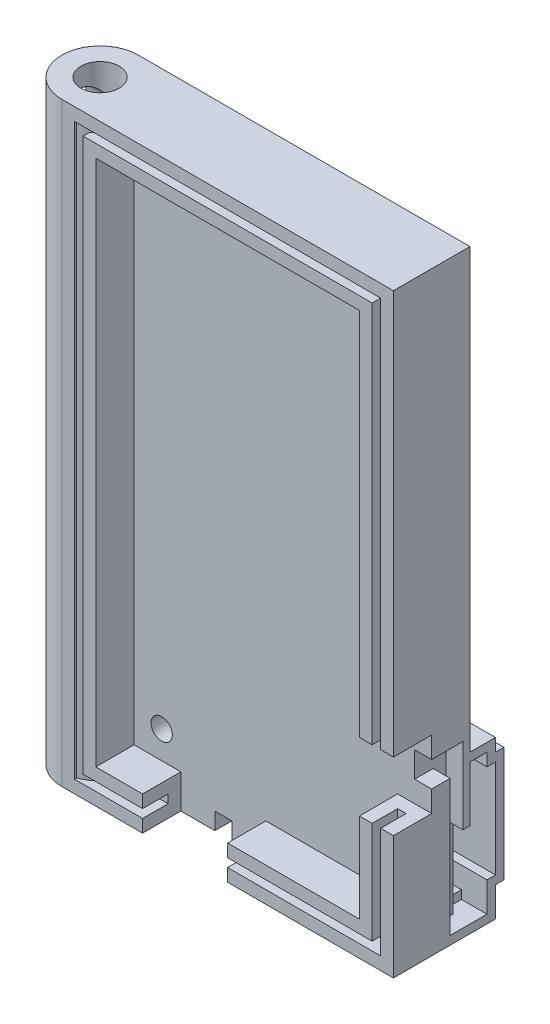
from build123d import *

# Parameters (mm, degrees)
SKETCH1_W                = 39
SKETCH1_H                = 70
BASE_DEPTH               = 4.5
SKETCH2_W                = 39
SKETCH2_H                = 70
SKETCH2_W_2              = 31
SKETCH2_H_2              = 62
WALLS_DEPTH              = 4.5
SKETCH3_W                = 10
SKETCH3_H                = 4.5
PWR_CONNECTOR_HOLE_DEPTH = 4
SKETCH4_W                = 4.5
SKETCH4_H                = 8
GPS_CONNECTOR_HOLE_DEPTH = 4
SKETCH5_R                = 1.25
MOUNTING_HOLES_DEPTH     = 4
GPS_MOUNT_DEPTH          = 3
SKETCH8_W                = 1
SKETCH8_H                = 1
GPS_RAILS_DEPTH          = 28
SKETCH9_W                = 1
SKETCH9_H                = 16.5
GPS_ROOF_DEPTH           = 14
SKETCH10_W               = 1
SKETCH10_H               = 1.5
SKETCH10_H_2             = 3.5
GPS_ROOF_2_DEPTH         = 17
SKETCH18_W               = 18
SKETCH18_H               = 1
CHIP_ROOF1_DEPTH         = 1
SKETCH19_W               = 18
SKETCH19_H               = 1
CHIP_ROOF2_DEPTH         = 12.5
SKETCH11_W               = 1
SKETCH11_H               = 3
PWR_CABLE_HOLDER1_DEPTH  = 3
PWR_CABLE_HOLDER2_DEPTH  = 2
GPS_CABLE_HOLDER_DEPTH   = 2
SKETCH14_W               = 36
SKETCH14_H               = 67
SKETCH14_W_2             = 34
SKETCH14_H_2             = 65
LID_MOUNT_DEPTH          = 3
SKETCH15_R               = 4.5
BALLON_MOUNT_DEPTH       = 70
SKETCH16_R               = 2.25
BALLOON_MOUNT_HOLE_DEPTH = 70
SKETCH17_W               = 2
SKETCH17_H               = 62
CORRECTION_DEPTH         = 4.5
SKETCH21_R               = 2.25
SAFETY_MOUNT_DEPTH       = 4.5


with BuildPart() as part:
    # Sketch1 → Base (new body)
    with BuildSketch(Plane.XY):
        with Locations((19.5, 35)):
            Rectangle(SKETCH1_W, SKETCH1_H)
    extrude(amount=BASE_DEPTH)

    # Sketch2 → Walls (add)
    with BuildSketch(Plane.XY.offset(4.5)):
        with Locations((19.5, 35)):
            Rectangle(SKETCH2_W, SKETCH2_H)
        with Locations((19.5, 35)):
            Rectangle(SKETCH2_W_2, SKETCH2_H_2, mode=Mode.SUBTRACT)
    extrude(amount=WALLS_DEPTH)

    # Sketch3 → PWR connector hole (cut)
    with BuildSketch(Plane(origin=(0, 4, 0), x_dir=(1, 0, 0), z_dir=(0, 1, 0))):
        with Locations((14.5, -6.75)):
            Rectangle(SKETCH3_W, SKETCH3_H)
    extrude(amount=-PWR_CONNECTOR_HOLE_DEPTH, mode=Mode.SUBTRACT)

    # Sketch4 → GPS connector hole (cut)
    with BuildSketch(Plane.ZY.offset(-35)):
        with Locations((6.75, 18.5)):
            Rectangle(SKETCH4_W, SKETCH4_H)
    extrude(amount=-GPS_CONNECTOR_HOLE_DEPTH, mode=Mode.SUBTRACT)

    # Sketch5 → Mounting holes (cut)
    with BuildSketch(Plane.XY.offset(4.5)):
        with Locations((7.25, 7.25)):
            Circle(SKETCH5_R)
        with Locations((31.75, 7.25)):
            Circle(SKETCH5_R)
        with Locations((7.25, 62.75)):
            Circle(SKETCH5_R)
    extrude(amount=-MOUNTING_HOLES_DEPTH, mode=Mode.SUBTRACT)

    # Sketch7 → GPS mount (add)
    with BuildSketch(Plane(origin=(0, 0, 0), x_dir=(-1, 0, 0), z_dir=(0, 0, -1))):
        Polygon((-8, 1), (-39, 1), (-39, 0), (-7, 0), (-7, 18.5), (-39, 18.5), (-39, 17.5), (-8, 17.5), align=None)
    extrude(amount=GPS_MOUNT_DEPTH)

    # Sketch8 → GPS rails (add)
    with BuildSketch(Plane(origin=(8, 0, 0), x_dir=(0, 0, -1), z_dir=(1, 0, 0))):
        with Locations((1.5, 17)):
            Rectangle(SKETCH8_W, SKETCH8_H)
        with Locations((1.5, 1.5)):
            Rectangle(SKETCH8_W, SKETCH8_H)
    extrude(amount=GPS_RAILS_DEPTH)

    # Sketch9 → GPS _roof (add)
    with BuildSketch(Plane(origin=(8, 0, 0), x_dir=(0, 0, -1), z_dir=(1, 0, 0))):
        with Locations((2.5, 9.25)):
            Rectangle(SKETCH9_W, SKETCH9_H)
    extrude(amount=GPS_ROOF_DEPTH)

    # Sketch10 → GPS _roof 2 (add)
    with BuildSketch(Plane(origin=(22, 0, 0), x_dir=(0, 0, -1), z_dir=(1, 0, 0))):
        with Locations((2.5, 16.75)):
            Rectangle(SKETCH10_W, SKETCH10_H)
        with Locations((2.5, 2.75)):
            Rectangle(SKETCH10_W, SKETCH10_H_2)
    extrude(amount=GPS_ROOF_2_DEPTH)

    # Sketch18 → Chip roof1 (add)
    with BuildSketch(Plane(origin=(0, 0, -3), x_dir=(-1, 0, 0), z_dir=(0, 0, -1))):
        with Locations((-30, 4)):
            Rectangle(SKETCH18_W, SKETCH18_H)
    extrude(amount=CHIP_ROOF1_DEPTH)

    # Sketch19 → Chip roof2 (add)
    with BuildSketch(Plane(origin=(0, 4.5, 0), x_dir=(1, 0, 0), z_dir=(0, 1, 0))):
        with Locations((30, 3.5)):
            Rectangle(SKETCH19_W, SKETCH19_H)
    extrude(amount=CHIP_ROOF2_DEPTH)

    # Sketch11 → PWR cable holder1 (add)
    with BuildSketch(Plane(origin=(0, 0, 0), x_dir=(-1, 0, 0), z_dir=(0, 0, -1))):
        Polygon((-5, 0), (-4, 0), (-4, 21.5), (-22, 21.5), (-22, 20.5), (-5, 20.5), align=None)
        with Locations((-27.5, 20)):
            Rectangle(SKETCH11_W, SKETCH11_H)
    extrude(amount=PWR_CABLE_HOLDER1_DEPTH)

    # Sketch12 → PWR cable holder2 (cut)
    with BuildSketch(Plane.XZ):
        Polygon((5, 2), (5, 0), (15.5, 0), (15.5, 4.5), (13.5, 4.5), (13.5, 2), align=None)
    extrude(amount=-PWR_CABLE_HOLDER2_DEPTH, mode=Mode.SUBTRACT)

    # Sketch13 → GPS cable holder (cut)
    with BuildSketch(Plane(origin=(39, 0, 0), x_dir=(0, 0, -1), z_dir=(1, 0, 0))):
        Polygon((-4.5, 20), (-4.5, 17), (-2.326586719, 17), (-2.326586719, 1), (0, 1), (0, 11), (-0.826586719, 11), (-0.826586719, 20), align=None)
    extrude(amount=-GPS_CABLE_HOLDER_DEPTH, mode=Mode.SUBTRACT)

    # Sketch14 → Lid mount (cut)
    with BuildSketch(Plane.XY.offset(9)):
        with Locations((19.5, 35)):
            Rectangle(SKETCH14_W, SKETCH14_H)
        with Locations((19.5, 35)):
            Rectangle(SKETCH14_W_2, SKETCH14_H_2, mode=Mode.SUBTRACT)
    extrude(amount=-LID_MOUNT_DEPTH, mode=Mode.SUBTRACT)

    # Sketch15 → Ballon mount (add)
    with BuildSketch(Plane.XZ):
        with Locations((0, 4.5)):
            Circle(SKETCH15_R)
    extrude(amount=-BALLON_MOUNT_DEPTH)

    # Sketch16 → Balloon mount hole (cut)
    with BuildSketch(Plane.XZ):
        with Locations((0, 4.5)):
            Circle(SKETCH16_R)
    extrude(amount=-BALLOON_MOUNT_HOLE_DEPTH, mode=Mode.SUBTRACT)

    # Sketch17 → Correction (cut)
    with BuildSketch(Plane.XY.offset(9)):
        with Locations((5, 35)):
            Rectangle(SKETCH17_W, SKETCH17_H)
    extrude(amount=-CORRECTION_DEPTH, mode=Mode.SUBTRACT)

    # Sketch21 → Safety mount (cut)
    with BuildSketch(Plane.ZY.offset(4.5)):
        with Locations((4.5, 4.5)):
            Circle(SKETCH21_R)
        with Locations((4.5, 65.5)):
            Circle(SKETCH21_R)
    extrude(amount=-SAFETY_MOUNT_DEPTH, mode=Mode.SUBTRACT)


solid = part.part
